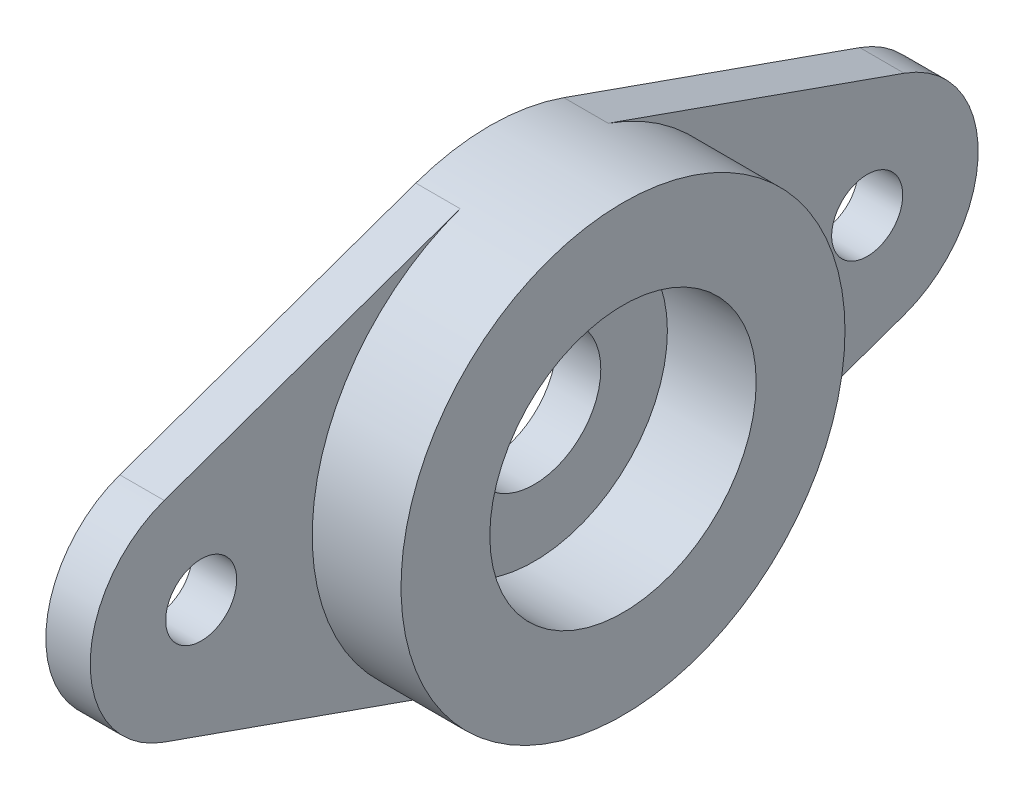
from build123d import *

# Parameters (mm, degrees)
SKETCH1_R             = 1.6
BOSS_EXTRUDE1_DEPTH   = 2
BOSS_EXTRUDE1_2_DEPTH = 2
BOSS_EXTRUDE2_DEPTH   = 6
BOSS_EXTRUDE3_DEPTH   = 2


with BuildPart() as part:
    # Sketch1 → Boss-Extrude1 (new body)
    with BuildSketch(Plane(origin=(0, 0, 0), x_dir=(0, 0, -1), z_dir=(1, 0, 0))):
        with BuildLine():
            Line((-3.333333333, 9.428090416), (-16.666666667, 4.714045208))
            ThreePointArc((-16.666666667, 4.714045208), (-20, 0), (-16.666666667, -4.714045208))
            Line((-16.666666667, -4.714045208), (-3.333333333, -9.428090416))
            ThreePointArc((-3.333333333, -9.428090416), (-10, 0), (-3.333333333, 9.428090416))
        make_face()
        with Locations((-15, 0)):
            Circle(SKETCH1_R, mode=Mode.SUBTRACT)
    extrude(amount=BOSS_EXTRUDE1_DEPTH)



with BuildPart() as body_2:
    # Sketch1 → Boss-Extrude1 2 (new body)
    with BuildSketch(Plane(origin=(0, 0, 0), x_dir=(0, 0, -1), z_dir=(1, 0, 0))):
        with BuildLine():
            Line((16.666666667, 4.714045208), (3.333333333, 9.428090416))
            ThreePointArc((3.333333333, 9.428090416), (10, 0), (3.333333333, -9.428090416))
            Line((3.333333333, -9.428090416), (16.666666667, -4.714045208))
            ThreePointArc((16.666666667, -4.714045208), (20, 0), (16.666666667, 4.714045208))
        make_face()
        with Locations((15, 0)):
            Circle(SKETCH1_R, mode=Mode.SUBTRACT)
    extrude(amount=BOSS_EXTRUDE1_2_DEPTH)


with BuildPart() as part_1:
    add(part.part)

    add(body_2.part)  # Boss-Extrude2 merges body 2
    # Sketch1<3> → Boss-Extrude2 (add)
    with BuildSketch(Plane(origin=(0, 0, 0), x_dir=(0, 0, -1), z_dir=(1, 0, 0))):
        with BuildLine():
            ThreePointArc((3.333333333, 9.428090416), (1.691019787, 9.855985597), (0, 10))
            ThreePointArc((0, 10), (-1.691019787, 9.855985597), (-3.333333333, 9.428090416))
            ThreePointArc((-3.333333333, 9.428090416), (-10, 0), (-3.333333333, -9.428090416))
            ThreePointArc((-3.333333333, -9.428090416), (0, -10), (3.333333333, -9.428090416))
            ThreePointArc((3.333333333, -9.428090416), (8.164965809, -5.773502692), (10, 0))
            ThreePointArc((10, 0), (8.164965809, 5.773502692), (3.333333333, 9.428090416))
        make_face()
        with BuildLine():
            ThreePointArc((6, 0), (-4.242640687, -4.242640687), (0, 6))
            ThreePointArc((0, 6), (4.242640687, 4.242640687), (6, 0))
        make_face(mode=Mode.SUBTRACT)
    extrude(amount=BOSS_EXTRUDE2_DEPTH)

    # Sketch1<4> → Boss-Extrude3 (add)
    with BuildSketch(Plane(origin=(0, 0, 0), x_dir=(0, 0, -1), z_dir=(1, 0, 0))):
        with BuildLine():
            ThreePointArc((6, 0), (4.242640687, 4.242640687), (0, 6))
            ThreePointArc((0, 6), (-4.242640687, -4.242640687), (6, 0))
        make_face()
        with BuildLine():
            ThreePointArc((3, 0), (-2.121320344, -2.121320344), (0, 3))
            ThreePointArc((0, 3), (2.121320344, 2.121320344), (3, 0))
        make_face(mode=Mode.SUBTRACT)
    extrude(amount=BOSS_EXTRUDE3_DEPTH)


solid = part_1.part
